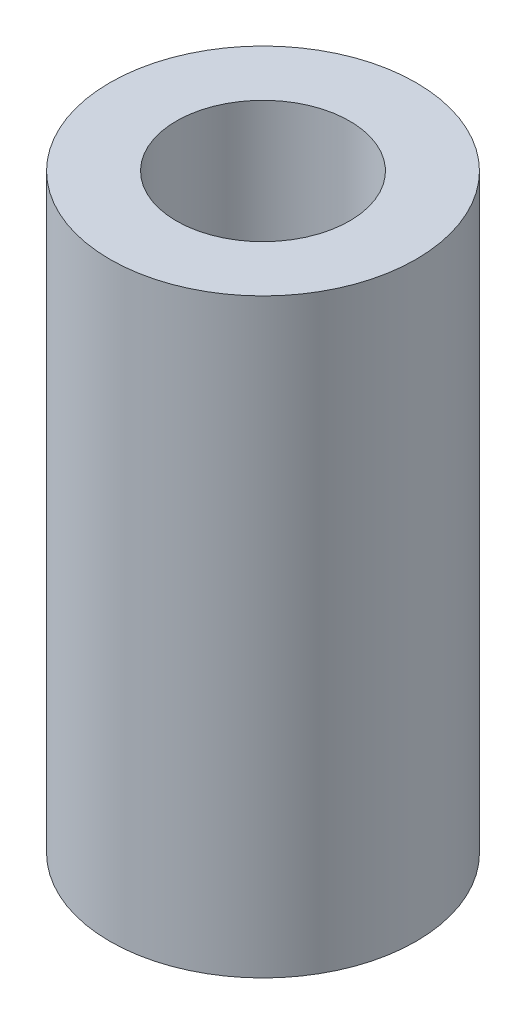
from build123d import *

# Parameters (mm, degrees)
SKETCH1_R           = 12.5
BOSS_EXTRUDE1_DEPTH = 48.236477472
SKETCH2_R           = 7.073934811
CUT_EXTRUDE1_DEPTH  = 52.373706883


with BuildPart() as part:
    # Sketch1 → Boss-Extrude1 (new body)
    with BuildSketch(Plane(origin=(0, 0, 0), x_dir=(1, 0, 0), z_dir=(0, 1, 0))):
        Circle(SKETCH1_R)
    extrude(amount=BOSS_EXTRUDE1_DEPTH)

    # Sketch2 → Cut-Extrude1 (cut, through all)
    with BuildSketch(Plane(origin=(0, 0, 0), x_dir=(1, 0, 0), z_dir=(0, 1, 0))):
        Circle(SKETCH2_R)
    extrude(amount=CUT_EXTRUDE1_DEPTH, mode=Mode.SUBTRACT)


solid = part.part
